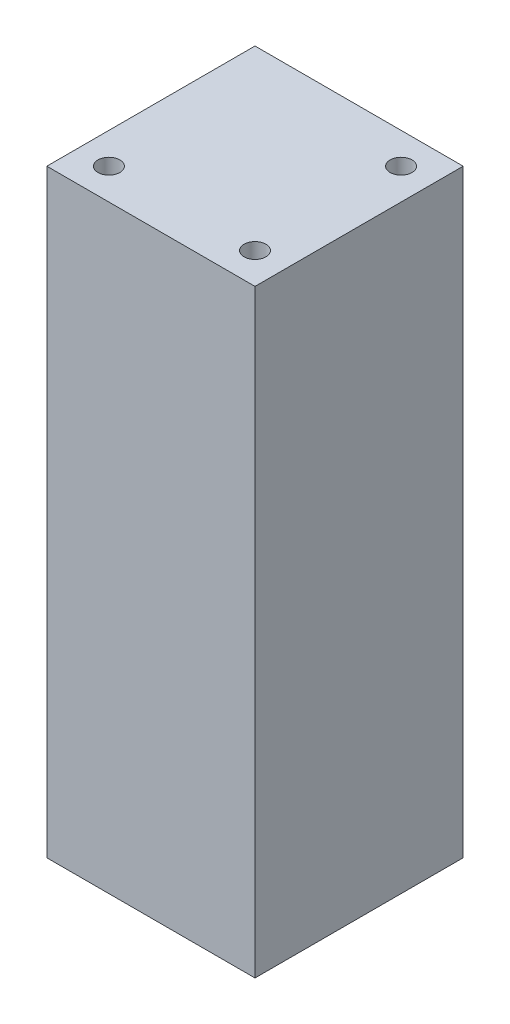
from build123d import *

# Parameters (mm, degrees)
SKETCH1_W           = 28.5
SKETCH1_H           = 28.5
BOSS_EXTRUDE1_DEPTH = 82
SKETCH2_R           = 1.5
CUT_EXTRUDE1_DEPTH  = 12


with BuildPart() as part:
    # Sketch1 → Boss-Extrude1 (new body)
    with BuildSketch(Plane(origin=(0, 0, 0), x_dir=(1, 0, 0), z_dir=(0, 1, 0))):
        Rectangle(SKETCH1_W, SKETCH1_H)
    extrude(amount=BOSS_EXTRUDE1_DEPTH)

    # Sketch2 → Cut-Extrude1 (cut)
    with BuildSketch(Plane(origin=(0, 82, 0), x_dir=(1, 0, 0), z_dir=(0, 1, 0))):
        with Locations((10, 10)):
            Circle(SKETCH2_R)
        with Locations((10, -10)):
            Circle(SKETCH2_R)
        with Locations((-10, -10)):
            Circle(SKETCH2_R)
    extrude(amount=-CUT_EXTRUDE1_DEPTH, mode=Mode.SUBTRACT)


solid = part.part
